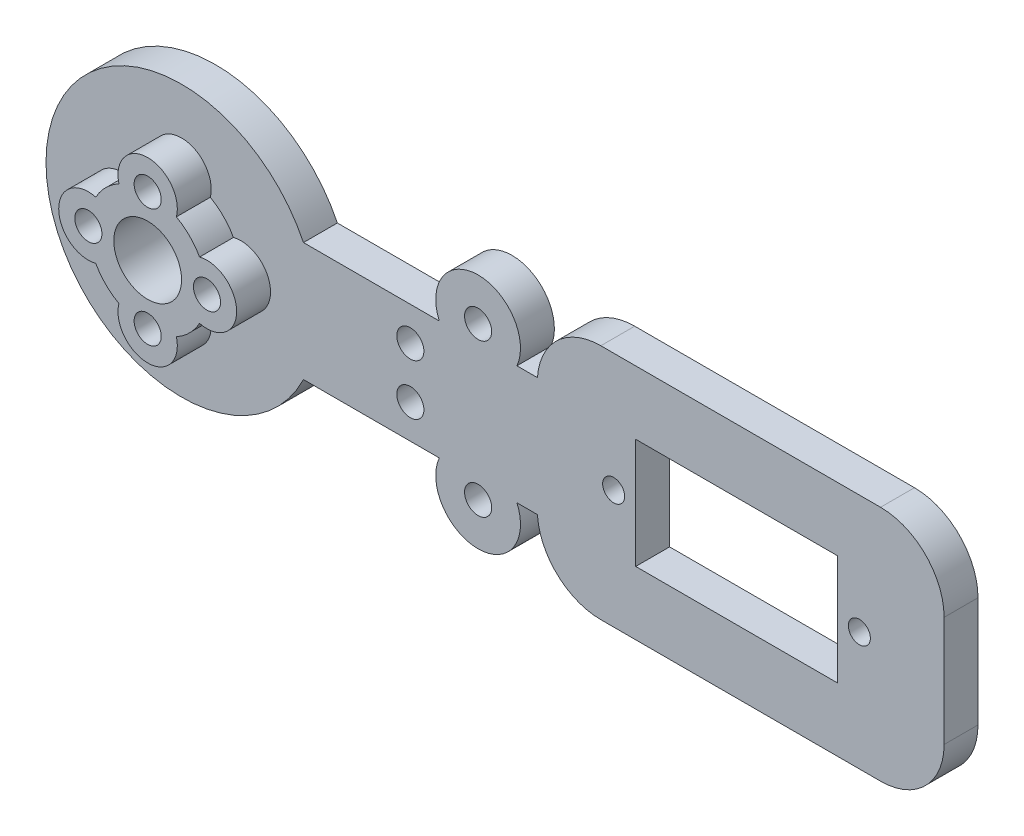
from build123d import *

# Parameters (mm, degrees)
MAIN_WEB_PROFILE_W                      = 60
MAIN_WEB_PROFILE_H                      = 14
MAIN_WEB_DEPTH                          = 4
SHOULDER_HORN_FLANGE_PROFILE_R          = 16
SHOULDER_HORN_FLANGE_DEPTH              = 4
ELBOW_SERVO_MOUNT_PROFILE_W             = 48
ELBOW_SERVO_MOUNT_PROFILE_H             = 28
ELBOW_SERVO_MOUNT_DEPTH                 = 4
SG90_BODY_CLEARANCE_START               = -5
SG90_BODY_CLEARANCE_PROFILE_W           = 23.8
SG90_BODY_CLEARANCE_PROFILE_H           = 13
SG90_BODY_CLEARANCE_DEPTH               = 97.49863387
ELBOW_TAB_FASTENERS_START               = -50
ELBOW_TAB_FASTENERS_PROFILE_R           = 1.3
ELBOW_TAB_FASTENERS_DEPTH               = 142.49863387
SHOULDER_CENTER_SCREW_ACCESS_START      = -50
SHOULDER_CENTER_SCREW_ACCESS_PROFILE_R  = 4
SHOULDER_CENTER_SCREW_ACCESS_DEPTH      = 142.49863387
CABLE_TIE_HOLES_START                   = -50
CABLE_TIE_HOLES_PROFILE_R               = 1.6
CABLE_TIE_HOLES_DEPTH                   = 142.49863387
PASSIVE_LOWER_MOUNT_BOSS_PROFILE_R      = 5
PASSIVE_LOWER_MOUNT_BOSS_DEPTH          = 4
PASSIVE_UPPER_MOUNT_BOSS_PROFILE_R      = 5
PASSIVE_UPPER_MOUNT_BOSS_DEPTH          = 4
PASSIVE_CHEEK_STANDOFFS_START           = -50
PASSIVE_CHEEK_STANDOFFS_PROFILE_R       = 1.6
PASSIVE_CHEEK_STANDOFFS_DEPTH           = 142.49863387
SHOULDER_DOWEL_SUPPORT_HUB_START        = 4
SHOULDER_DOWEL_SUPPORT_HUB_PROFILE_R    = 7
SHOULDER_DOWEL_SUPPORT_HUB_PROFILE_R_2  = 4
SHOULDER_DOWEL_SUPPORT_HUB_DEPTH        = 4
RAISED_M3_WASHER_SEATS_HEIGHT8_START    = 4
RAISED_M3_WASHER_SEATS_PCD14_PROFILE_R  = 3.5
RAISED_M3_WASHER_SEATS_HEIGHT8_DEPTH    = 4
METAL_HORN_M3_CLEARANCE_PCD14_START     = -50
METAL_HORN_M3_CLEARANCE_PCD14_PROFILE_R = 1.6
METAL_HORN_M3_CLEARANCE_PCD14_DEPTH     = 142.760557976
RESTORE_SHOULDER_SLEEVE_BORE_START      = -50
RESTORE_SHOULDER_SLEEVE_BORE_PROFILE_R  = 4
RESTORE_SHOULDER_SLEEVE_BORE_DEPTH      = 142.760557976
FILLET1_R                               = 7.5


with BuildPart() as part:
    # Main_web_profile → Main_web (new body)
    with BuildSketch(Plane.XY):
        with Locations((30, 0)):
            Rectangle(MAIN_WEB_PROFILE_W, MAIN_WEB_PROFILE_H)
    extrude(amount=MAIN_WEB_DEPTH)

    # Shoulder_horn_flange_profile → Shoulder_horn_flange (add)
    with BuildSketch(Plane.XY):
        Circle(SHOULDER_HORN_FLANGE_PROFILE_R)
    extrude(amount=SHOULDER_HORN_FLANGE_DEPTH)

    # Elbow_servo_mount_profile → Elbow_servo_mount (add)
    with BuildSketch(Plane.XY):
        with Locations((66, 0)):
            Rectangle(ELBOW_SERVO_MOUNT_PROFILE_W, ELBOW_SERVO_MOUNT_PROFILE_H)
    extrude(amount=ELBOW_SERVO_MOUNT_DEPTH)

    # SG90_body_clearance_profile → SG90_body_clearance (cut, through all)
    with BuildSketch(Plane.XY.offset(SG90_BODY_CLEARANCE_START)):
        with Locations((65.5, 0)):
            Rectangle(SG90_BODY_CLEARANCE_PROFILE_W, SG90_BODY_CLEARANCE_PROFILE_H)
    extrude(amount=SG90_BODY_CLEARANCE_DEPTH, mode=Mode.SUBTRACT)

    # Elbow_tab_fasteners_profile → Elbow_tab_fasteners (cut, through all)
    with BuildSketch(Plane.XY.offset(ELBOW_TAB_FASTENERS_START)):
        with Locations(Location((51, 0, 0), (0, 0, 180))):
            Circle(ELBOW_TAB_FASTENERS_PROFILE_R)
        with Locations(Location((80, 0, 0), (0, 0, 180))):
            Circle(ELBOW_TAB_FASTENERS_PROFILE_R)
    extrude(amount=ELBOW_TAB_FASTENERS_DEPTH, mode=Mode.SUBTRACT)

    # Shoulder_center_screw_access_profile → Shoulder_center_screw_access (cut, through all)
    with BuildSketch(Plane.XY.offset(SHOULDER_CENTER_SCREW_ACCESS_START)):
        with Locations(Location((0, 0, 0), (0, 0, 180))):
            Circle(SHOULDER_CENTER_SCREW_ACCESS_PROFILE_R)
    extrude(amount=SHOULDER_CENTER_SCREW_ACCESS_DEPTH, mode=Mode.SUBTRACT)

    # Cable_tie_holes_profile → Cable_tie_holes (cut, through all)
    with BuildSketch(Plane.XY.offset(CABLE_TIE_HOLES_START)):
        with Locations(Location((27, -3, 0), (0, 0, 180))):
            Circle(CABLE_TIE_HOLES_PROFILE_R)
        with Locations(Location((27, 3, 0), (0, 0, 180))):
            Circle(CABLE_TIE_HOLES_PROFILE_R)
    extrude(amount=CABLE_TIE_HOLES_DEPTH, mode=Mode.SUBTRACT)

    # Passive_lower_mount_boss_profile → Passive_lower_mount_boss (add)
    with BuildSketch(Plane.XY):
        with Locations((35, -9)):
            Circle(PASSIVE_LOWER_MOUNT_BOSS_PROFILE_R)
    extrude(amount=PASSIVE_LOWER_MOUNT_BOSS_DEPTH)

    # Passive_upper_mount_boss_profile → Passive_upper_mount_boss (add)
    with BuildSketch(Plane.XY):
        with Locations((35, 9)):
            Circle(PASSIVE_UPPER_MOUNT_BOSS_PROFILE_R)
    extrude(amount=PASSIVE_UPPER_MOUNT_BOSS_DEPTH)

    # Passive_cheek_standoffs_profile → Passive_cheek_standoffs (cut, through all)
    with BuildSketch(Plane.XY.offset(PASSIVE_CHEEK_STANDOFFS_START)):
        with Locations(Location((35, -9, 0), (0, 0, 180))):
            Circle(PASSIVE_CHEEK_STANDOFFS_PROFILE_R)
        with Locations(Location((35, 9, 0), (0, 0, 180))):
            Circle(PASSIVE_CHEEK_STANDOFFS_PROFILE_R)
    extrude(amount=PASSIVE_CHEEK_STANDOFFS_DEPTH, mode=Mode.SUBTRACT)

    # Shoulder_dowel_support_hub_profile → Shoulder_dowel_support_hub (add)
    with BuildSketch(Plane.XY.offset(SHOULDER_DOWEL_SUPPORT_HUB_START)):
        Circle(SHOULDER_DOWEL_SUPPORT_HUB_PROFILE_R)
        with Locations(Location((0, 0, 0), (0, 0, 180))):
            Circle(SHOULDER_DOWEL_SUPPORT_HUB_PROFILE_R_2, mode=Mode.SUBTRACT)
    extrude(amount=SHOULDER_DOWEL_SUPPORT_HUB_DEPTH)

    # Raised_M3_washer_seats_PCD14_profile → Raised_M3_washer_seats_height8 (add)
    with BuildSketch(Plane.XY.offset(RAISED_M3_WASHER_SEATS_HEIGHT8_START)):
        with Locations((7, 0)):
            Circle(RAISED_M3_WASHER_SEATS_PCD14_PROFILE_R)
        with Locations((-7, 0)):
            Circle(RAISED_M3_WASHER_SEATS_PCD14_PROFILE_R)
        with Locations((0, 7)):
            Circle(RAISED_M3_WASHER_SEATS_PCD14_PROFILE_R)
        with Locations((0, -7)):
            Circle(RAISED_M3_WASHER_SEATS_PCD14_PROFILE_R)
    extrude(amount=RAISED_M3_WASHER_SEATS_HEIGHT8_DEPTH)

    # Metal_horn_M3_clearance_PCD14_profile → Metal_horn_M3_clearance_PCD14 (cut, through all)
    with BuildSketch(Plane.XY.offset(METAL_HORN_M3_CLEARANCE_PCD14_START)):
        with Locations(Location((7, 0, 0), (0, 0, 180))):
            Circle(METAL_HORN_M3_CLEARANCE_PCD14_PROFILE_R)
        with Locations(Location((-7, 0, 0), (0, 0, 180))):
            Circle(METAL_HORN_M3_CLEARANCE_PCD14_PROFILE_R)
        with Locations(Location((0, 7, 0), (0, 0, 180))):
            Circle(METAL_HORN_M3_CLEARANCE_PCD14_PROFILE_R)
        with Locations(Location((0, -7, 0), (0, 0, 180))):
            Circle(METAL_HORN_M3_CLEARANCE_PCD14_PROFILE_R)
    extrude(amount=METAL_HORN_M3_CLEARANCE_PCD14_DEPTH, mode=Mode.SUBTRACT)

    # Restore_shoulder_sleeve_bore_profile → Restore_shoulder_sleeve_bore (cut, through all)
    with BuildSketch(Plane.XY.offset(RESTORE_SHOULDER_SLEEVE_BORE_START)):
        with Locations(Location((0, 0, 0), (0, 0, 180))):
            Circle(RESTORE_SHOULDER_SLEEVE_BORE_PROFILE_R)
    extrude(amount=RESTORE_SHOULDER_SLEEVE_BORE_DEPTH, mode=Mode.SUBTRACT)

    # Fillet1
    # the kernel refuses this fillet: 7.5 mm, written as the material it takes off along each edge
    with BuildSketch(Plane(origin=(42, -14, -18.708286934), x_dir=(0, 1, 0), z_dir=(0, 0, 1))) as fillet1_piece_1:
        with BuildLine():
            CenterArc((7.5, -7.483314774), FILLET1_R, 93.822553729, 86.177446271)
            Line((0, -7.483314774), (-0.15, -7.483314774))
            Line((-0.15, -7.483314774), (-0.15, 0))
            Line((-0.15, 0), (0, 0.15))
            ThreePointArc((0, 0.15), (3.5, 0.15), (6.99, 0.149666295))
            Line((6.99, 0.149666295), (7, 0))
        make_face()
    extrude(amount=41.416573868, mode=Mode.SUBTRACT)
    with BuildSketch(Plane(origin=(90, -14, -18.75), x_dir=(-1, 0, 0), z_dir=(0, 0, 1)), Plane(origin=(90, 14, -18.75), x_dir=(0, -1, 0), z_dir=(0, 0, 1))) as fillet1_piece_2:
        with BuildLine():
            CenterArc((FILLET1_R, -FILLET1_R), FILLET1_R, 90, 90)
            Line((0, -FILLET1_R), (-FILLET1_R * 0.02, -FILLET1_R))
            Line((-FILLET1_R * 0.02, -FILLET1_R), (-FILLET1_R * 0.02, FILLET1_R * 0.02))
            Line((-FILLET1_R * 0.02, FILLET1_R * 0.02), (FILLET1_R, FILLET1_R * 0.02))
            Line((FILLET1_R, FILLET1_R * 0.02), (FILLET1_R, 0))
        make_face()
    extrude(amount=41.5, mode=Mode.SUBTRACT)
    with BuildSketch(Plane(origin=(42, 14, -18.708286934), x_dir=(0, -1, 0), z_dir=(0, 0, 1))) as fillet1_piece_3:
        with BuildLine():
            CenterArc((7.5, 7.483314774), FILLET1_R, 180, 86.177446271)
            Line((0, 7.483314774), (-0.15, 7.483314774))
            Line((-0.15, 7.483314774), (-0.15, 0))
            Line((-0.15, 0), (0, -0.15))
            ThreePointArc((0, -0.15), (3.5, -0.15), (6.99, -0.149666295))
            Line((6.99, -0.149666295), (7, 0))
        make_face()
    extrude(amount=41.416573868, mode=Mode.SUBTRACT)


solid = part.part
